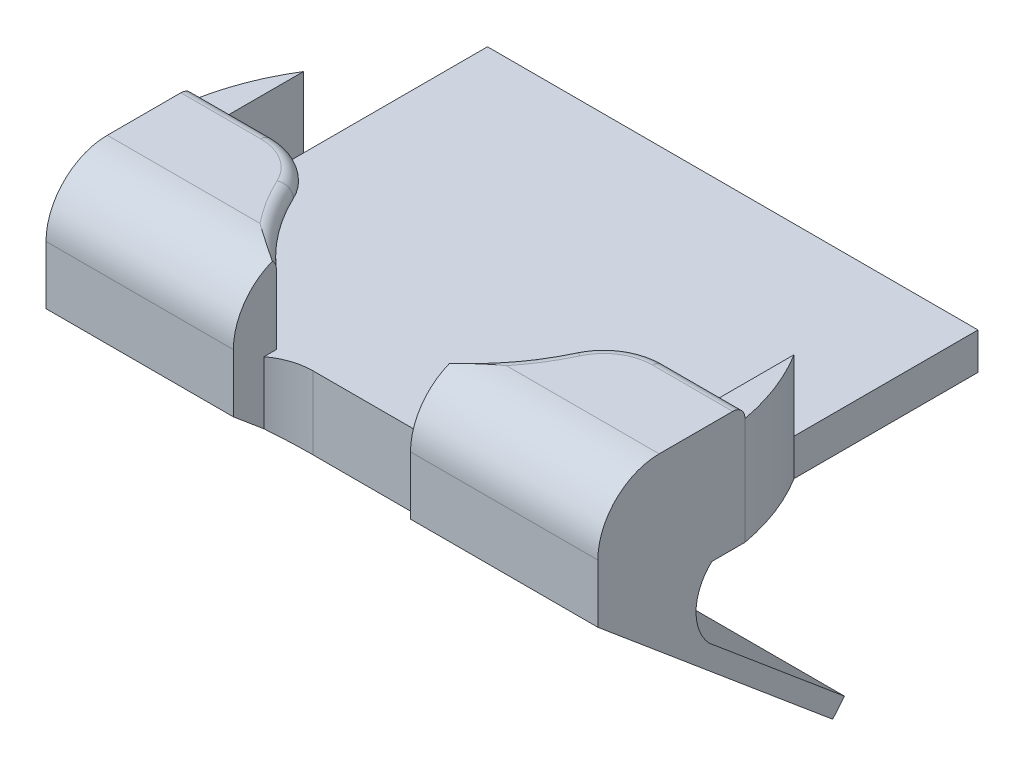
from build123d import *

# Parameters (mm, degrees)
SKETCH1_W           = 80
SKETCH1_H           = 60
BOSS_EXTRUDE1_DEPTH = 6
SKETCH2_W           = 5
SKETCH2_H           = 17
BOSS_EXTRUDE2_DEPTH = 11.5
BOSS_EXTRUDE3_DEPTH = 6
BOSS_EXTRUDE4_START = 6
BOSS_EXTRUDE4_DEPTH = 6
BOSS_EXTRUDE5_DEPTH = 2
SKETCH6_W           = 30.556561627
SKETCH6_H           = 19.5
BOSS_EXTRUDE6_DEPTH = 2
FILLET1_R           = 10
FILLET2_R           = 2
BOSS_EXTRUDE7_DEPTH = 5
BOSS_EXTRUDE8_DEPTH = 5
FILLET3_START       = -45
FILLET3_DEPTH       = 90
BOSS_EXTRUDE9_REACH = 101.243
CUT_EXTRUDE1_DEPTH  = 67.535252268


with BuildPart() as part:
    # Sketch1 → Boss-Extrude1 (new body)
    with BuildSketch(Plane(origin=(0, 0, 0), x_dir=(1, 0, 0), z_dir=(0, 1, 0))):
        Rectangle(SKETCH1_W, SKETCH1_H)
    extrude(amount=BOSS_EXTRUDE1_DEPTH)



with BuildPart() as body_2:
    # Sketch2 → Boss-Extrude2 (new body)
    with BuildSketch(Plane(origin=(0, 6, 0), x_dir=(1, 0, 0), z_dir=(0, 1, 0))):
        with BuildLine():
            Line((-45, -13), (-40, -13))
            Line((-40, -13), (-40, 0))
            ThreePointArc((-40, 0), (-43.110841292, -6.265061041), (-45, -13))
        make_face()
        with Locations((-42.5, -21.5)):
            Rectangle(SKETCH2_W, SKETCH2_H)
        with BuildLine():
            Line((40, 0), (40, -13))
            Line((40, -13), (45, -13))
            ThreePointArc((45, -13), (43.110841292, -6.265061041), (40, 0))
        make_face()
        with Locations((42.5, -21.5)):
            Rectangle(SKETCH2_W, SKETCH2_H)
    extrude(amount=BOSS_EXTRUDE2_DEPTH)


with BuildPart() as part_1:
    add(part.part)

    add(body_2.part)  # Boss-Extrude3 merges body 2
    # Sketch3 → Boss-Extrude3 (add)
    with BuildSketch(Plane.XZ.offset(-6)):
        with BuildLine():
            Line((-40, 0), (-40, 30))
            Line((-40, 30), (-45, 30))
            Line((-45, 30), (-45, 13))
            ThreePointArc((-45, 13), (-43.110841292, 6.265061041), (-40, 0))
        make_face()
    extrude(amount=BOSS_EXTRUDE3_DEPTH)

    # Sketch4 → Boss-Extrude4 (add)
    with BuildSketch(Plane.XZ.offset(-6).offset(BOSS_EXTRUDE4_START)):
        with BuildLine():
            Line((40, 30), (40, 0))
            ThreePointArc((40, 0), (43.110841292, 6.265061041), (45, 13))
            Line((45, 13), (45, 30))
            Line((45, 30), (40, 30))
        make_face()
    extrude(amount=-BOSS_EXTRUDE4_DEPTH)

    # Sketch5 → Boss-Extrude5 (add)
    with BuildSketch(Plane(origin=(0, 17.5, 0), x_dir=(1, 0, 0), z_dir=(0, 1, 0))):
        with BuildLine():
            Line((-14.443438373, -30), (-25, -30))
            Line((-25, -30), (-45, -30))
            Line((-45, -30), (-45, -13))
            Line((-45, -13), (-31.955163637, -13))
            ThreePointArc((-31.955163637, -13), (-26.592535057, -14.559489665), (-22.902499246, -18.751557058))
            ThreePointArc((-22.902499246, -18.751557058), (-19.254329924, -24.812974066), (-14.443438373, -30))
        make_face()
        with BuildLine():
            Line((45, -30), (45, -13))
            Line((45, -13), (31.955163637, -13))
            ThreePointArc((31.955163637, -13), (26.592535057, -14.559489665), (22.902499246, -18.751557058))
            ThreePointArc((22.902499246, -18.751557058), (19.254329924, -24.812974066), (14.443438373, -30))
            Line((14.443438373, -30), (25, -30))
            Line((25, -30), (45, -30))
        make_face()
    extrude(amount=BOSS_EXTRUDE5_DEPTH)

    # Sketch6 → Boss-Extrude6 (add)
    with BuildSketch(Plane.XY.offset(30)):
        with Locations((-29.721719186, 9.75)):
            Rectangle(SKETCH6_W, SKETCH6_H)
        with Locations((29.721719186, 9.75)):
            Rectangle(SKETCH6_W, SKETCH6_H)
    extrude(amount=BOSS_EXTRUDE6_DEPTH)

    # Fillet1
    # the kernel refuses this fillet: 10 mm, written as the material it adds along each edge
    with BuildSketch(Plane(origin=(14.443438373, 0, 30), x_dir=(-1, 0, 0), z_dir=(0, 1, 0))) as fillet1_piece_1:
        with BuildLine():
            CenterArc((6, 10), FILLET1_R, 233.130102354, 36.869897646)
            Line((0, 2), (0, 0))
            Line((0, 0), (6, 0))
        make_face()
    extrude(amount=6)
    with BuildSketch(Plane(origin=(-14.443438373, 0, 30), x_dir=(1, 0, 0), z_dir=(0, 1, 0))) as fillet1_piece_2:
        with BuildLine():
            CenterArc((6, -10), FILLET1_R, 90, 36.869897646)
            Line((0, -2), (0, 0))
            Line((0, 0), (6, 0))
        make_face()
    extrude(amount=6)

    # Fillet2
    fillet2_edges = [part_1.edges().sort_by_distance(p)[0] for p in [
        (38.477581818, 19.5, 13),
        (19.254329924, 19.5, 24.812974066),
        (-19.254329924, 19.5, 24.812974066),
        (-26.592535057, 19.5, 14.559489665),
        (26.592535057, 19.5, 14.559489665),
        (-38.477581818, 19.5, 13),
    ]]
    fillet(fillet2_edges, radius=FILLET2_R - 0.0001)  # a hair under: the kernel refuses the full size

    # Sketch7 → Boss-Extrude7 (add)
    with BuildSketch(Plane.XY.offset(32)):
        with BuildLine():
            Line((45, 19.5), (15.184151192, 19.5))
            add(Edge.make_bspline(
                [(15.184151192, 19.5), (14.93580845, 19.5), (14.688907154, 19.481115197), (14.443438373, 19.443462601)],
                knots=[0, 0, 0, 0, 1, 1, 1, 1], degree=3))
            Line((14.443438373, 19.443462601), (14.443438373, 6))
            Line((14.443438373, 6), (14.443438373, 0))
            Line((14.443438373, 0), (45, 0))
            Line((45, 0), (45, 19.5))
        make_face()
    extrude(amount=BOSS_EXTRUDE7_DEPTH)

    # Sketch8 → Boss-Extrude8 (add)
    with BuildSketch(Plane.XY.offset(32)):
        with BuildLine():
            Line((-14.443438373, 6), (-14.443438373, 19.443462601))
            add(Edge.make_bspline(
                [(-14.443438373, 19.443462601), (-14.688907154, 19.481115197), (-14.93580845, 19.5), (-15.184151192, 19.5)],
                knots=[0, 0, 0, 0, 1, 1, 1, 1], degree=3))
            Line((-15.184151192, 19.5), (-45, 19.5))
            Line((-45, 19.5), (-45, 0))
            Line((-45, 0), (-14.443438373, 0))
            Line((-14.443438373, 0), (-14.443438373, 6))
        make_face()
    extrude(amount=BOSS_EXTRUDE8_DEPTH)

    # Fillet3: read off the stored shape, not the designer's step
    # Fillet3 outline → Fillet3 (cut)
    with BuildSketch(Plane.YZ.offset(FILLET3_START)):
        with BuildLine():
            Line((19.5, 37), (9.5, 37))
            ThreePointArc((9.5, 37), (16.571067812, 34.071067812), (19.5, 27))
            Line((19.5, 27), (19.5, 37))
        make_face()
    extrude(amount=FILLET3_DEPTH, mode=Mode.SUBTRACT)

    # Boss-Extrude9: up to this face of the body (flat: up to its plane)
    boss_extrude9_end = Plane(part_1.part.faces().sort_by_distance((-45, 9.370161856, 24.55198813))[0])
    # Sketch9 → Boss-Extrude9 (add, up to the picked face)
    with BuildSketch(Plane(origin=(45, 0, 0), x_dir=(0, 0, -1), z_dir=(1, 0, 0)), mode=Mode.PRIVATE) as boss_extrude9_sk1:
        with BuildLine():
            Line((-37, 0), (-18.411320002, 0))
            ThreePointArc((-18.411320002, 0), (-20.982100343, -5.549822615), (-18.87559935, -11.291956033))
            Line((-18.87559935, -11.291956033), (3.230584985, -29.841247155))
            Line((3.230584985, -29.841247155), (1.302222156, -32.139380484))
            Line((1.302222156, -32.139380484), (-37, 0))
        make_face()
    boss_extrude9_tool1 = split(extrude(boss_extrude9_sk1.sketch, amount=-BOSS_EXTRUDE9_REACH, mode=Mode.PRIVATE), bisect_by=boss_extrude9_end, keep=Keep.BOTH, mode=Mode.PRIVATE)
    add(boss_extrude9_tool1.solids().sort_by(Axis((45, -11.881572, 18.599139), (-1, 0, 0)))[0])

    # Sketch10 → Cut-Extrude1 (cut, through all)
    with BuildSketch(Plane(origin=(0, 0, 0), x_dir=(1, 0, 0), z_dir=(0, 1, 0))):
        with BuildLine():
            Line((-14.443438373, -37), (14.443438373, -37))
            Line((14.443438373, -37), (14.443438373, -32))
            ThreePointArc((14.443438373, -32), (11.605716034, -30.513167019), (8.443438373, -30))
            Line((8.443438373, -30), (-8.443438373, -30))
            ThreePointArc((-8.443438373, -30), (-11.605716034, -30.513167019), (-14.443438373, -32))
            Line((-14.443438373, -32), (-14.443438373, -37))
        make_face()
    extrude(amount=-CUT_EXTRUDE1_DEPTH, mode=Mode.SUBTRACT)


solid = part_1.part
